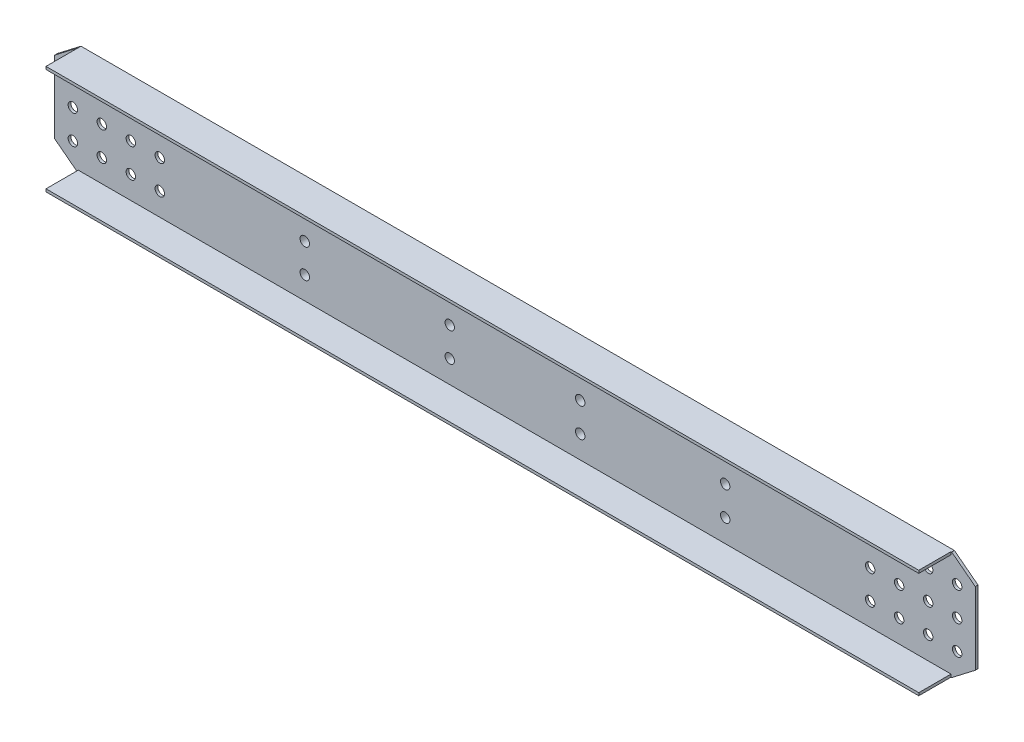
from build123d import *

# Parameters (mm, degrees)
SKETCH_1_R          = 13
EXTRUDE_779_DEPTH   = 7.5
SKETCH_2_W          = 2408.049034164
SKETCH_2_H          = 7.5
EXTRUDE_1_DEPTH     = 89
SKETCH_3_W          = 80
SKETCH_3_H          = 240
EXTRUDE_2_DEPTH     = 16
SKETCH_4_R          = 13
CUT_EXTRUDE_1_DEPTH = 1308.983562588


with BuildPart() as part:
    # 草图1 → Extrude 779 (new body)
    with BuildSketch(Plane.XY):
        Polygon((-1205, 0), (1205, 0), (1270, 50), (1270, 250), (1205, 300), (-1205, 300), (-1270, 250), (-1270, 50), align=None)
        with Locations((-1220, 230)):
            Circle(SKETCH_1_R, mode=Mode.SUBTRACT)
        with Locations((-1220, 150)):
            Circle(SKETCH_1_R, mode=Mode.SUBTRACT)
        with Locations((-1140, 230)):
            Circle(SKETCH_1_R, mode=Mode.SUBTRACT)
        with Locations((-1140, 150)):
            Circle(SKETCH_1_R, mode=Mode.SUBTRACT)
        with Locations((-1060, 230)):
            Circle(SKETCH_1_R, mode=Mode.SUBTRACT)
        with Locations((-1060, 150)):
            Circle(SKETCH_1_R, mode=Mode.SUBTRACT)
        with Locations((-980, 150)):
            Circle(SKETCH_1_R, mode=Mode.SUBTRACT)
        with Locations((-1060, 70)):
            Circle(SKETCH_1_R, mode=Mode.SUBTRACT)
        with Locations((-1140, 70)):
            Circle(SKETCH_1_R, mode=Mode.SUBTRACT)
        with Locations((-1220, 70)):
            Circle(SKETCH_1_R, mode=Mode.SUBTRACT)
        with Locations((1220, 70)):
            Circle(SKETCH_1_R, mode=Mode.SUBTRACT)
        with Locations((1140, 70)):
            Circle(SKETCH_1_R, mode=Mode.SUBTRACT)
        with Locations((1060, 70)):
            Circle(SKETCH_1_R, mode=Mode.SUBTRACT)
        with Locations((980, 150)):
            Circle(SKETCH_1_R, mode=Mode.SUBTRACT)
        with Locations((1060, 150)):
            Circle(SKETCH_1_R, mode=Mode.SUBTRACT)
        with Locations((1060, 230)):
            Circle(SKETCH_1_R, mode=Mode.SUBTRACT)
        with Locations((1140, 150)):
            Circle(SKETCH_1_R, mode=Mode.SUBTRACT)
        with Locations((1140, 230)):
            Circle(SKETCH_1_R, mode=Mode.SUBTRACT)
        with Locations((1220, 150)):
            Circle(SKETCH_1_R, mode=Mode.SUBTRACT)
        with Locations((1220, 230)):
            Circle(SKETCH_1_R, mode=Mode.SUBTRACT)
        with Locations((-980, 70)):
            Circle(SKETCH_1_R, mode=Mode.SUBTRACT)
        with Locations((-980, 230)):
            Circle(SKETCH_1_R, mode=Mode.SUBTRACT)
        with Locations((980, 70)):
            Circle(SKETCH_1_R, mode=Mode.SUBTRACT)
        with Locations((980, 230)):
            Circle(SKETCH_1_R, mode=Mode.SUBTRACT)
    extrude(amount=-EXTRUDE_779_DEPTH)

    # 草图2 → 凸台-拉伸1 (add)
    with BuildSketch(Plane.XY):
        with Locations((-0.975482918, 296.25)):
            Rectangle(SKETCH_2_W, SKETCH_2_H)
        with Locations((-0.975482918, 3.75)):
            Rectangle(SKETCH_2_W, SKETCH_2_H)
    extrude(amount=EXTRUDE_1_DEPTH)

    # 草图3 → 凸台-拉伸2 (add)
    with BuildSketch(Plane(origin=(0, 0, -7.5), x_dir=(-1, 0, 0), z_dir=(0, 0, -1))):
        with Locations((-580, 150)):
            Rectangle(SKETCH_3_W, SKETCH_3_H)
        with Locations((-180, 150)):
            Rectangle(SKETCH_3_W, SKETCH_3_H)
        with Locations((180, 150)):
            Rectangle(SKETCH_3_W, SKETCH_3_H)
        with Locations((580, 150)):
            Rectangle(SKETCH_3_W, SKETCH_3_H)
    extrude(amount=EXTRUDE_2_DEPTH)

    # 草图4 → 切除-拉伸1 (cut, through all)
    with BuildSketch(Plane.XY):
        with Locations((-580, 230)):
            Circle(SKETCH_4_R)
        with Locations((-580, 150)):
            Circle(SKETCH_4_R)
        with Locations((-180, 230)):
            Circle(SKETCH_4_R)
        with Locations((-180, 150)):
            Circle(SKETCH_4_R)
        with Locations((-180, 70)):
            Circle(SKETCH_4_R)
        with Locations((-580, 70)):
            Circle(SKETCH_4_R)
        with Locations((580, 70)):
            Circle(SKETCH_4_R)
        with Locations((180, 70)):
            Circle(SKETCH_4_R)
        with Locations((180, 150)):
            Circle(SKETCH_4_R)
        with Locations((180, 230)):
            Circle(SKETCH_4_R)
        with Locations((580, 150)):
            Circle(SKETCH_4_R)
        with Locations((580, 230)):
            Circle(SKETCH_4_R)
    extrude(amount=-CUT_EXTRUDE_1_DEPTH, mode=Mode.SUBTRACT)


solid = part.part
